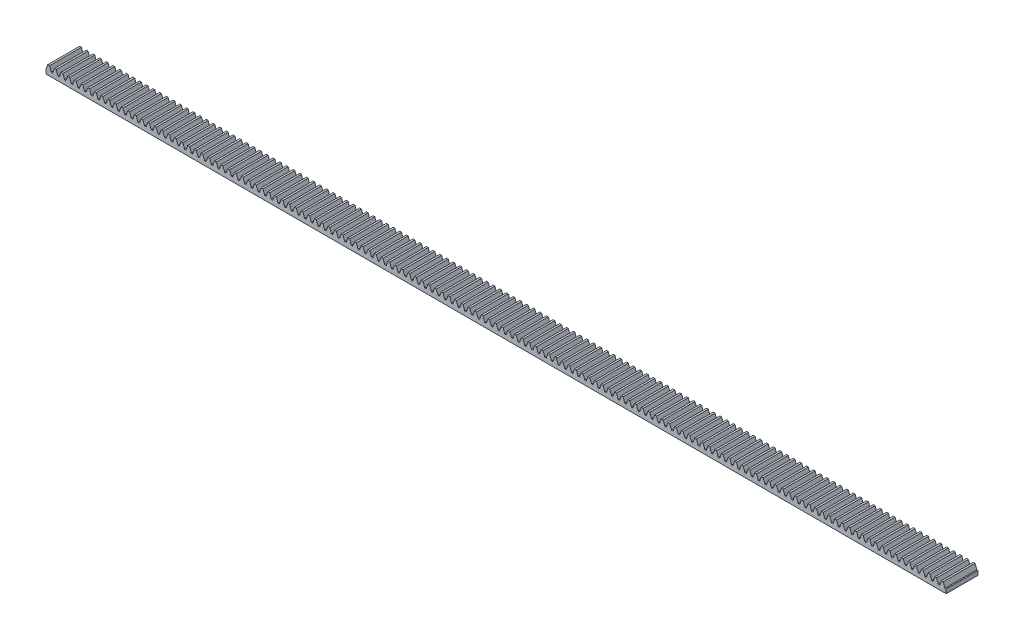
from build123d import *

# Parameters (mm, degrees)
SKETCH_1_W             = 424
SKETCH_1_H             = 2
EXTRUDE_1_DEPTH        = 15
EXTRUDE_2_DEPTH        = 15
PATTERN_LINEAR_3_COUNT = 135
PATTERN_LINEAR_3_PITCH = 3.14159265


with BuildPart() as part:
    # 草图1 → 拉伸1 (new body)
    with BuildSketch(Plane.XY):
        with Locations((212, -1)):
            Rectangle(SKETCH_1_W, SKETCH_1_H)
    extrude(amount=EXTRUDE_1_DEPTH)

    # 草图2 → 拉伸2 (add)
    with BuildSketch(Plane.XY.offset(15)):
        Polygon((0, 0), (0.818933027, 2.25), (1.661788885, 2.25), (2.480721912, 0), align=None)
    extrude_2 = extrude(amount=-EXTRUDE_2_DEPTH)

    # 阵列(线性)3: 拉伸2 ×135
    with Locations(*[(i * PATTERN_LINEAR_3_PITCH, 0, 0) for i in range(1, PATTERN_LINEAR_3_COUNT)]):
        add(extrude_2)


solid = part.part
